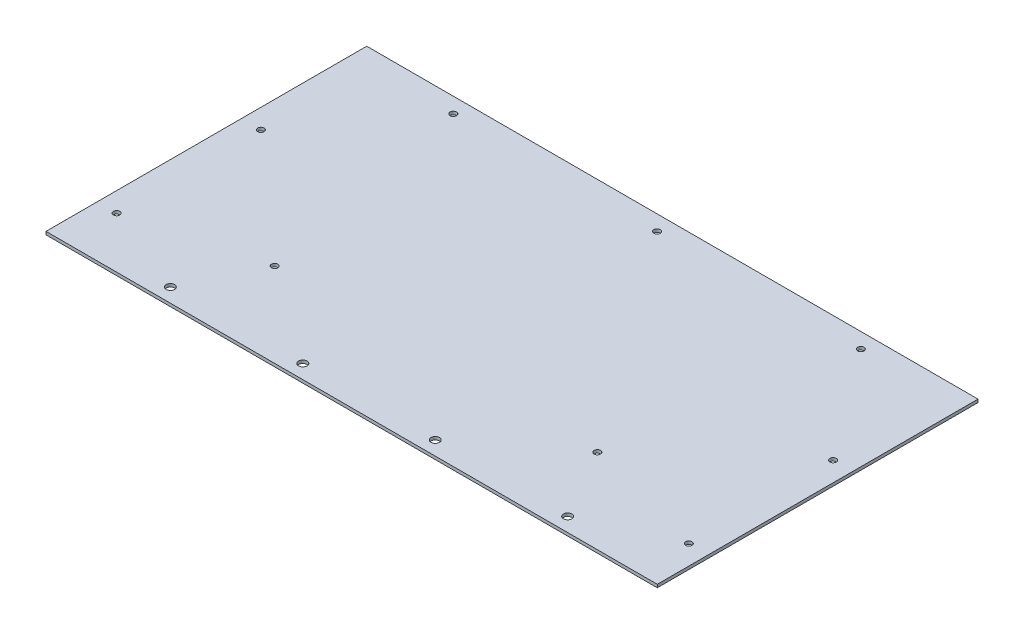
from build123d import *

# Parameters (mm, degrees)
SKETCH1_W            = 457.223
SKETCH1_H            = 2.286
BOSS_EXTRUDE1_DEPTH  = 238.315200026
SKETCH9_R            = 3.175
CUT_EXTRUDE10_DEPTH  = 2.54
LPATTERN1_COUNT      = 4
LPATTERN1_PITCH      = 99.06
SKETCH15_W           = 457.223
SKETCH15_H           = 2.286
BOSS_EXTRUDE3_DEPTH  = 1.5875
M4_CLEARANCE_HOLE1_D = 4.8


with BuildPart() as part:
    # Sketch1 → Boss-Extrude1 (new body)
    with BuildSketch(Plane.XY):
        Rectangle(SKETCH1_W, SKETCH1_H)
    extrude(amount=BOSS_EXTRUDE1_DEPTH)

    # Sketch9 → Cut-Extrude10 (cut)
    with BuildSketch(Plane(origin=(0, 1.143, 0), x_dir=(1, 0, 0), z_dir=(0, 1, 0))):
        with Locations((-146.0615, -229.425200026)):
            Circle(SKETCH9_R)
    cut_extrude10 = extrude(amount=-CUT_EXTRUDE10_DEPTH, mode=Mode.SUBTRACT)

    # LPattern1: Cut-Extrude10 ×4
    with Locations(*[(i * LPATTERN1_PITCH, 0, 0) for i in range(1, LPATTERN1_COUNT)]):
        add(cut_extrude10, mode=Mode.SUBTRACT)

    # Sketch15 → Boss-Extrude3 (add)
    with BuildSketch(Plane.XY.offset(238.315200026)):
        Rectangle(SKETCH15_W, SKETCH15_H)
    extrude(amount=BOSS_EXTRUDE3_DEPTH)

    # M4 Clearance Hole1 (through all)
    with Locations(Plane.XZ.offset(1.143)):
        with Locations((-214.0065, 201.724823778), (-214.0065, 93.774823778), (-152.4, 11.43), (0, 11.43), (152.4, 11.43), (214.0065, 93.774823778), (214.0065, 201.724823778), (120.65, 176.776), (-120.65, 176.776)):
            Hole(M4_CLEARANCE_HOLE1_D / 2)


solid = part.part
